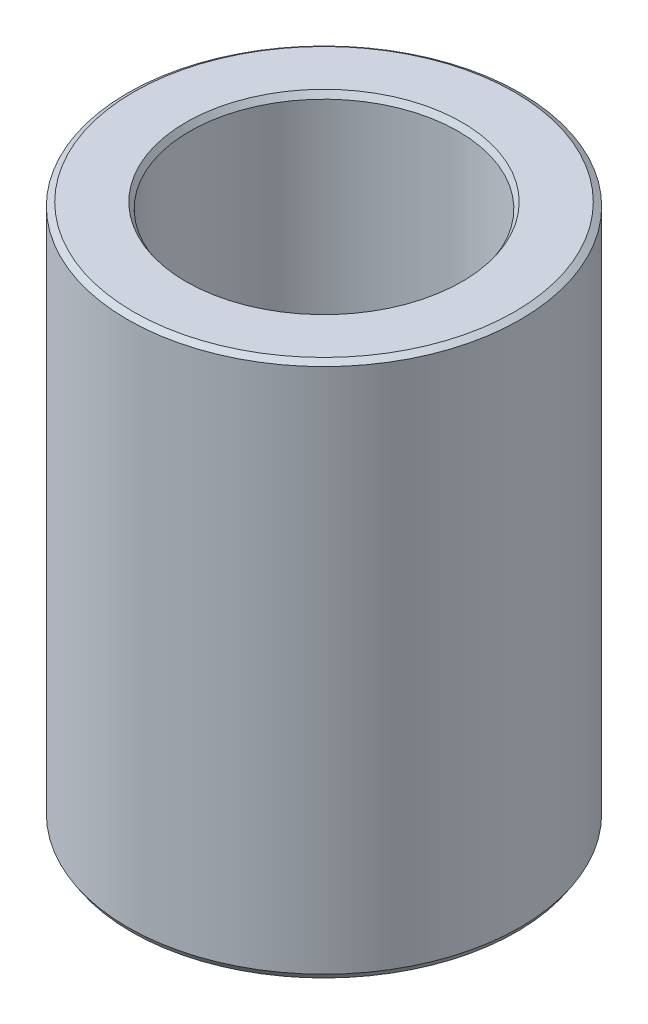
from build123d import *
from OCP.BRepFilletAPI import BRepFilletAPI_MakeChamfer

# Parameters (mm, degrees)
SKETCH1_R           = 22.5
BOSS_EXTRUDE1_DEPTH = 61.413010719
SKETCH2_R           = 15.386990923
CUT_EXTRUDE1_DEPTH  = 70.166884313
CHAMFER1_SIZE       = 0.431347837
CHAMFER1_SIZE2      = 0.677872392


with BuildPart() as part:
    # Sketch1 → Boss-Extrude1 (new body)
    with BuildSketch(Plane(origin=(0, 0, 0), x_dir=(1, 0, 0), z_dir=(0, 1, 0))):
        Circle(SKETCH1_R)
    extrude(amount=BOSS_EXTRUDE1_DEPTH)

    # Sketch2 → Cut-Extrude1 (cut, through all)
    with BuildSketch(Plane(origin=(0, 0, 0), x_dir=(1, 0, 0), z_dir=(0, 1, 0))):
        Circle(SKETCH2_R)
    extrude(amount=CUT_EXTRUDE1_DEPTH, mode=Mode.SUBTRACT)

    # Chamfer1: one chamfer whose edges measure the first distance from different faces: ONE call of the kernel's chamfer builder (chamfer() names one face for all edges)
    chamfer1_edges_1 = [part.edges().sort_by_distance(p)[0] for p in [
        (-15.386990923, 61.413010719, 0),
    ]]
    chamfer1_side_1 = [part.faces().sort_by_distance(p)[0] for p in [
        (-21.863603897, 61.413010719, 0),
    ]]
    chamfer1_edges_2 = [part.edges().sort_by_distance(p)[0] for p in [
        (-15.386990923, 0, 0),
    ]]
    chamfer1_side_2 = [part.faces().sort_by_distance(p)[0] for p in [
        (-15.386990923, 30.706505359, 0),
    ]]
    chamfer1_edges_3 = [part.edges().sort_by_distance(p)[0] for p in [
        (-22.5, 0, 0),
    ]]
    chamfer1_side_3 = [part.faces().sort_by_distance(p)[0] for p in [
        (-21.863603897, 0, 0),
    ]]
    chamfer1_edges_4 = [part.edges().sort_by_distance(p)[0] for p in [
        (-22.5, 61.413010719, 0),
    ]]
    chamfer1_side_4 = [part.faces().sort_by_distance(p)[0] for p in [
        (-22.5, 30.706505359, 0),
    ]]
    chamfer1 = BRepFilletAPI_MakeChamfer(part.part.solid().wrapped)
    for e in chamfer1_edges_1:
        chamfer1.Add(CHAMFER1_SIZE, CHAMFER1_SIZE2, e.wrapped, chamfer1_side_1[0].wrapped)  # the first distance lies on this face
    for e in chamfer1_edges_2:
        chamfer1.Add(CHAMFER1_SIZE, CHAMFER1_SIZE2, e.wrapped, chamfer1_side_2[0].wrapped)  # the first distance lies on this face
    for e in chamfer1_edges_3:
        chamfer1.Add(CHAMFER1_SIZE, CHAMFER1_SIZE2, e.wrapped, chamfer1_side_3[0].wrapped)  # the first distance lies on this face
    for e in chamfer1_edges_4:
        chamfer1.Add(CHAMFER1_SIZE, CHAMFER1_SIZE2, e.wrapped, chamfer1_side_4[0].wrapped)  # the first distance lies on this face
    add(Compound.cast(chamfer1.Shape()), mode=Mode.REPLACE)


solid = part.part
